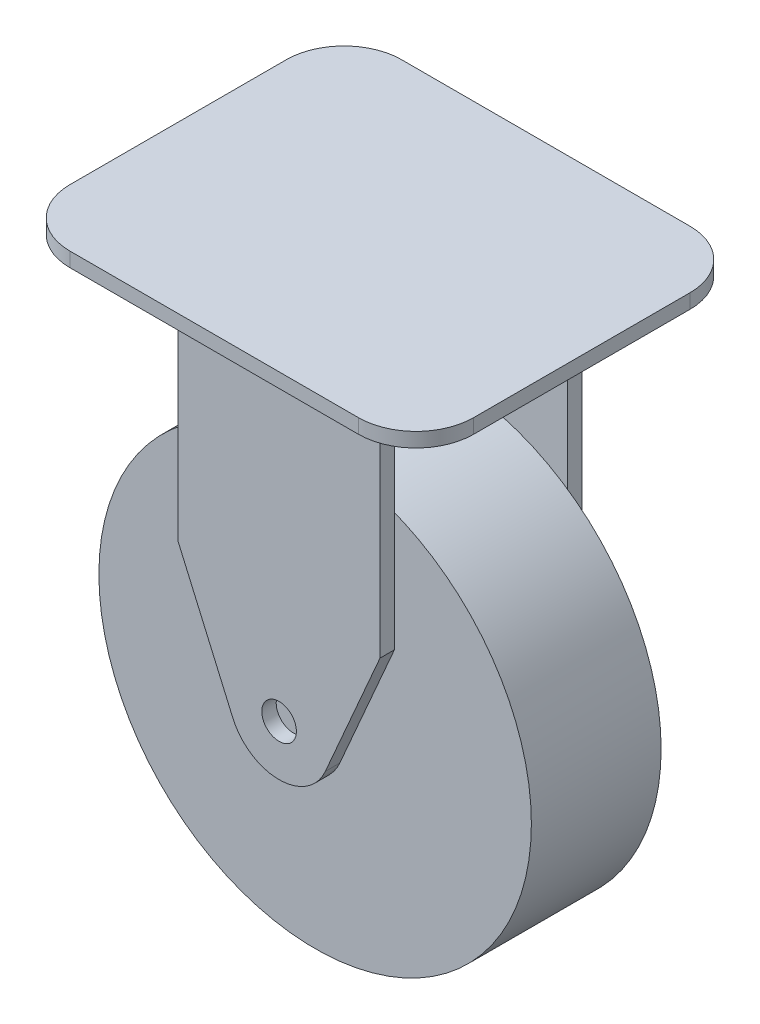
from build123d import *

# Parameters (mm, degrees)
BOSS_EXTRUDE1_DEPTH = 5
BOSS_EXTRUDE2_DEPTH = 11
FILLET1_R           = 10
FILLET2_R           = 8
BOSS_EXTRUDE3_DEPTH = 5
SKETCH4_R           = 6.000000000000002
BOSS_EXTRUDE4_DEPTH = 5
SKETCH5_R           = 75.00000000000001
BOSS_EXTRUDE5_DEPTH = 22.5


with BuildPart() as part:
    # Sketch1 → Boss-Extrude1 (new body)
    with BuildSketch(Plane(origin=(0, 0, 0), x_dir=(1, 0, 0), z_dir=(0, 1, 0))):
        with BuildLine():
            Line((-49.999999999999865, 57.49999999999999), (49.99999999999988, 57.49999999999999))
            ThreePointArc((49.99999999999988, 57.49999999999999), (64.14213562373095, 51.642135623730944), (70, 37.499999999999865))
            Line((70, 37.499999999999865), (70.00000000000003, -37.49999999999986))
            ThreePointArc((70.00000000000003, -37.49999999999986), (64.14213562373098, -51.64213562373095), (49.99999999999989, -57.5))
            Line((49.99999999999989, -57.5), (-49.99999999999985, -57.5))
            ThreePointArc((-49.99999999999985, -57.5), (-64.14213562373095, -51.642135623730944), (-69.99999999999999, -37.49999999999986))
            Line((-69.99999999999999, -37.49999999999986), (-70, 37.49999999999985))
            ThreePointArc((-70, 37.49999999999985), (-64.14213562373095, 51.64213562373094), (-49.999999999999865, 57.49999999999999))
        make_face()
    extrude(amount=-BOSS_EXTRUDE1_DEPTH)

    # Sketch2 → Boss-Extrude2 (add)
    with BuildSketch(Plane.XZ.offset(5)):
        with BuildLine():
            Line((-54.999999999999986, 32.5), (-55.00000000000001, -32.49999999999999))
            ThreePointArc((-55.00000000000001, -32.49999999999999), (-52.07106781186548, -39.571067811865476), (-45, -42.49999999999999))
            Line((-45, -42.49999999999999), (45.000000000000014, -42.499999999999986))
            ThreePointArc((45.000000000000014, -42.499999999999986), (52.07106781186548, -39.57106781186546), (55.00000000000002, -32.5))
            Line((55.00000000000002, -32.5), (55.00000000000003, 32.5))
            ThreePointArc((55.00000000000003, 32.5), (52.07106781186551, 39.571067811865476), (45.000000000000036, 42.5))
            Line((45.000000000000036, 42.5), (-45, 42.49999999999999))
            ThreePointArc((-45, 42.49999999999999), (-52.07106781186546, 39.57106781186547), (-54.999999999999986, 32.5))
        make_face()
    extrude(amount=BOSS_EXTRUDE2_DEPTH)

    # Fillet1
    fillet1_edges = [part.edges().sort_by_distance(p)[0] for p in [
        (-52.07106781186548, -5, -39.571067811865476),
        (7.11e-15, -5, -42.499999999999986),
        (52.07106781186548, -5, -39.57106781186546),
        (55.00000000000003, -5, 0),
        (52.07106781186551, -5, 39.571067811865476),
        (2.132e-14, -5, 42.5),
        (-52.07106781186546, -5, 39.57106781186547),
        (-55, -5, 0),
    ]]
    fillet(fillet1_edges, radius=FILLET1_R)

    # Fillet2
    # the kernel refuses this fillet: 8 mm, written as the material it takes off along each edge
    with BuildSketch(Plane(origin=(-44.999999999999986, -16, 32.5), x_dir=(-1.42e-15, 0, 1), z_dir=(1, 0, 1.42e-15))) as fillet2_piece_1:
        with BuildLine():
            CenterArc((3.4168760482229885, -7.9999999999999964), FILLET2_R, 22.885380476158534, 67.11461952384147)
            Line((3.4168760482229885, 3.55e-15), (3.4168760482229885, 0.8000000000000043))
            Line((3.4168760482229885, 0.8000000000000043), (10, 0.8000000000000007))
            Line((10, 0.8000000000000007), (10.799999999999997, 0))
            ThreePointArc((10.799999999999997, 0), (10.799999999999997, -1.0000000000000053), (11.52418109131397, -4.577777777777779))
            Line((11.52418109131397, -4.577777777777779), (10.787153360123881, -4.888888888888889))
        make_face()
    revolve(axis=Axis((-44.999999999999986, -16, 32.5), (0, -1, 0)), revolution_arc=89.99999999999993, mode=Mode.SUBTRACT)
    with BuildSketch(Plane(origin=(45.000000000000036, -16, 42.5), x_dir=(0, 0.987284800910229, 0.15896138490730852), z_dir=(-1, 0, -8e-17))) as fillet2_piece_2:
        with BuildLine():
            CenterArc((6.8518159068908835, 7.771109299355987), FILLET2_R, 189.14661643898233, 67.11461952384138)
            Line((-1.0464625003909451, 6.499418220097512), (-1.8362903411191291, 6.372249112171666))
            Line((-1.8362903411191291, 6.372249112171666), (-0.7898278407281839, -0.12716910792584693))
            Line((-0.7898278407281839, -0.12716910792584693), (0.12716910792584638, -0.7898278407281804))
            ThreePointArc((0.12716910792584638, -0.7898278407281804), (1.1144539088360754, -0.6308664558208719), (4.761856359069408, -0.7771109299355986))
            Line((4.761856359069408, -0.7771109299355986), (4.9518526815986315, -1e-17))
        make_face()
    extrude(amount=90.00000000000003, mode=Mode.SUBTRACT)
    with BuildSketch(Plane(origin=(45.00000000000004, -16, 32.500000000000014), x_dir=(1, 0, -1.42e-15), z_dir=(-1.42e-15, 0, -1))) as fillet2_piece_3:
        with BuildLine():
            CenterArc((3.4168760482229814, -7.999999999999998), FILLET2_R, 22.885380476158563, 67.11461952384144)
            Line((3.4168760482229814, 0), (3.4168760482229814, 0.8000000000000007))
            Line((3.4168760482229814, 0.8000000000000007), (9.999999999999986, 0.8000000000000007))
            Line((9.999999999999986, 0.8000000000000007), (10.799999999999983, 0))
            ThreePointArc((10.799999999999983, 0), (10.799999999999983, -1.0000000000000018), (11.524181091313956, -4.5777777777777775))
            Line((11.524181091313956, -4.5777777777777775), (10.787153360123867, -4.888888888888889))
        make_face()
    revolve(axis=Axis((45.00000000000004, -16, 32.500000000000014), (0, -1, 0)), revolution_arc=90.00000000000013, mode=Mode.SUBTRACT)
    with BuildSketch(Plane(origin=(55.00000000000002, -16, -32.5), x_dir=(0.15896138490730993, 0.9872848009102289, 0), z_dir=(1.1e-16, 0, 1))) as fillet2_piece_4:
        with BuildLine():
            CenterArc((6.851815906890875, 7.771109299355992), FILLET2_R, 189.14661643898236, 67.1146195238415)
            Line((-1.0464625003909545, 6.499418220097512), (-1.8362903411191382, 6.372249112171664))
            Line((-1.8362903411191382, 6.372249112171664), (-0.7898278407281838, -0.12716910792584807))
            Line((-0.7898278407281838, -0.12716910792584807), (0.12716910792584749, -0.7898278407281802))
            ThreePointArc((0.12716910792584749, -0.7898278407281802), (1.1144539088360774, -0.6308664558208774), (4.7618563590694105, -0.7771109299355988))
            Line((4.7618563590694105, -0.7771109299355988), (4.951852681598634, 8e-17))
        make_face()
    extrude(amount=65, mode=Mode.SUBTRACT)
    with BuildSketch(Plane(origin=(45, -16, -32.499999999999964), x_dir=(1.42e-15, 0, -1), z_dir=(-1, 0, -1.42e-15))) as fillet2_piece_5:
        with BuildLine():
            CenterArc((3.416876048223024, -7.9999999999999964), FILLET2_R, 22.885380476158556, 67.1146195238415)
            Line((3.416876048223017, 3.55e-15), (3.416876048223017, 0.8000000000000043))
            Line((3.416876048223017, 0.8000000000000043), (10.000000000000021, 0.8000000000000007))
            Line((10.000000000000021, 0.8000000000000007), (10.800000000000018, 0))
            ThreePointArc((10.800000000000018, 0), (10.800000000000018, -1.0000000000000018), (11.524181091314006, -4.577777777777774))
            Line((11.524181091314006, -4.577777777777774), (10.787153360123916, -4.888888888888886))
        make_face()
    revolve(axis=Axis((45, -16, -32.499999999999964), (0, -1, 0)), revolution_arc=89.99999999999972, mode=Mode.SUBTRACT)
    with BuildSketch(Plane(origin=(-45, -16, -42.49999999999999), x_dir=(0, 0.987284800910229, -0.15896138490730852), z_dir=(1, 0, 8e-17))) as fillet2_piece_6:
        with BuildLine():
            CenterArc((6.8518159068908835, 7.771109299355987), FILLET2_R, 189.14661643898233, 67.11461952384138)
            Line((-1.0464625003909451, 6.499418220097512), (-1.8362903411191291, 6.372249112171666))
            Line((-1.8362903411191291, 6.372249112171666), (-0.7898278407281839, -0.12716910792584693))
            Line((-0.7898278407281839, -0.12716910792584693), (0.12716910792584638, -0.7898278407281804))
            ThreePointArc((0.12716910792584638, -0.7898278407281804), (1.1144539088360754, -0.6308664558208719), (4.761856359069408, -0.7771109299355986))
            Line((4.761856359069408, -0.7771109299355986), (4.9518526815986315, -1e-17))
        make_face()
    extrude(amount=90.00000000000001, mode=Mode.SUBTRACT)
    with BuildSketch(Plane(origin=(-45.000000000000014, -16, -32.50000000000001), x_dir=(-1, 0, 1.42e-15), z_dir=(1.42e-15, 0, 1))) as fillet2_piece_7:
        with BuildLine():
            CenterArc((3.4168760482229885, -7.999999999999998), FILLET2_R, 22.885380476158545, 67.11461952384145)
            Line((3.4168760482229885, 0), (3.4168760482229885, 0.8000000000000007))
            Line((3.4168760482229885, 0.8000000000000007), (9.999999999999986, 0.8000000000000007))
            Line((9.999999999999986, 0.8000000000000007), (10.799999999999983, 0))
            ThreePointArc((10.799999999999983, 0), (10.799999999999983, -1.0000000000000018), (11.52418109131397, -4.5777777777777775))
            Line((11.52418109131397, -4.5777777777777775), (10.787153360123881, -4.888888888888889))
        make_face()
    revolve(axis=Axis((-45.000000000000014, -16, -32.50000000000001), (0, -1, 0)), revolution_arc=90.00000000000017, mode=Mode.SUBTRACT)
    with BuildSketch(Plane(origin=(-54.999999999999986, -16, 32.5), x_dir=(-0.15896138490730852, 0.987284800910229, 0), z_dir=(-3.3e-16, 0, -1))) as fillet2_piece_8:
        with BuildLine():
            CenterArc((6.8518159068908835, 7.771109299355987), FILLET2_R, 189.14661643898228, 67.1146195238415)
            Line((-1.0464625003909462, 6.499418220097519), (-1.83629034111913, 6.372249112171672))
            Line((-1.83629034111913, 6.372249112171672), (-0.7898278407281839, -0.12716910792584693))
            Line((-0.7898278407281839, -0.12716910792584693), (0.12716910792584638, -0.7898278407281804))
            ThreePointArc((0.12716910792584638, -0.7898278407281804), (1.1144539088360754, -0.6308664558208719), (4.761856359069408, -0.7771109299355987))
            Line((4.761856359069408, -0.7771109299355987), (4.951852681598632, 4e-17))
        make_face()
    extrude(amount=65, mode=Mode.SUBTRACT)

    # Sketch3 → Boss-Extrude3 (add)
    with BuildSketch(Plane.XZ.offset(16)):
        Polygon((-35.00000000000001, 35), (34.99999999999999, 35), (34.99999999999999, -35), (-35, -35), align=None)
    extrude(amount=BOSS_EXTRUDE3_DEPTH)

    # Sketch4 → Boss-Extrude4 (add)
    with BuildSketch(Plane(origin=(0, 0, -35), x_dir=(-1, 0, 0), z_dir=(0, 0, -1))):
        with BuildLine():
            Line((-34.99999999999999, -21), (-34.999999999999986, -91.00000000000001))
            Line((-34.999999999999986, -91.00000000000001), (-16.042254413814177, -134.49257272557526))
            ThreePointArc((-16.042254413814177, -134.49257272557526), (1.925e-14, -145), (16.04225441381421, -134.49257272557526))
            Line((16.04225441381421, -134.49257272557526), (35.00000000000001, -91))
            Line((35.00000000000001, -91), (35, -21))
            Line((35, -21), (-34.99999999999999, -21))
        make_face()
        with Locations((1.818e-14, -127.5)):
            Circle(SKETCH4_R, mode=Mode.SUBTRACT)
    boss_extrude4 = extrude(amount=-BOSS_EXTRUDE4_DEPTH)

    # Mirror1: Boss-Extrude4 across plane
    add(boss_extrude4.mirror(Plane.XY))


with BuildPart() as body_2:
    # Sketch5 → Boss-Extrude5 (new, symmetric)
    with BuildSketch(Plane.XY):
        with Locations(Location((0, -127.02013928772499, 0), (0, 0, 180))):
            Circle(SKETCH5_R)
    extrude(amount=BOSS_EXTRUDE5_DEPTH, both=True)


solid = Compound([part.part, body_2.part])
